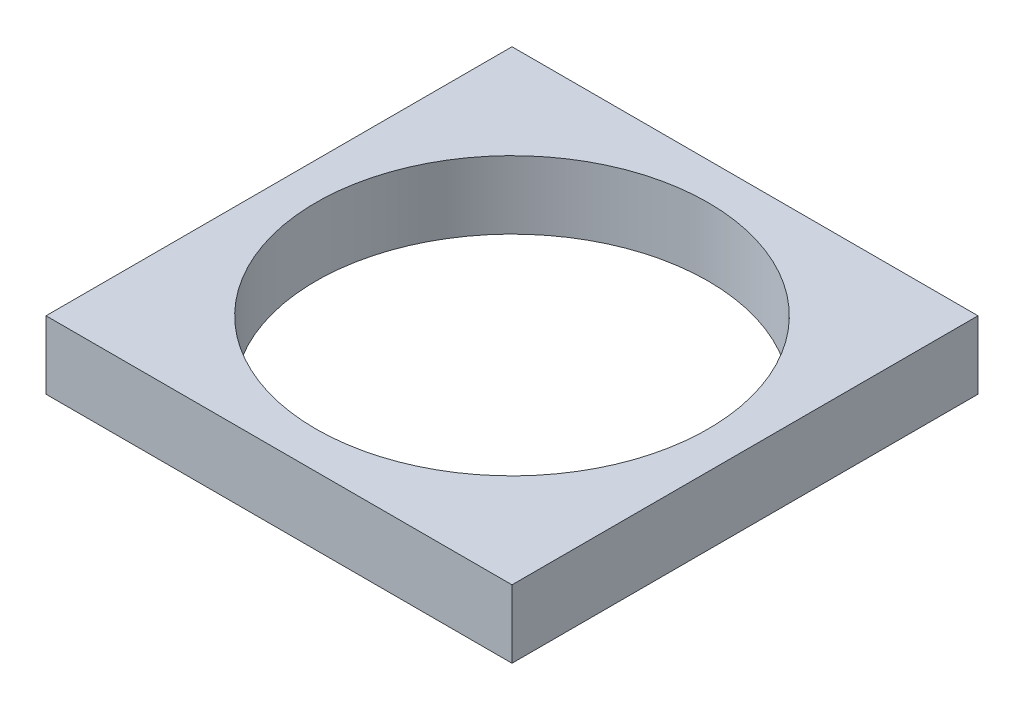
from build123d import *

# Parameters (mm, degrees)
SKETCH1_W           = 152.4
SKETCH1_H           = 152.4
SKETCH1_R           = 64.135
BOSS_EXTRUDE1_DEPTH = 22.225


with BuildPart() as part:
    # Sketch1 → Boss-Extrude1 (new body)
    with BuildSketch(Plane(origin=(0, 0, 0), x_dir=(1, 0, 0), z_dir=(0, 1, 0))):
        Rectangle(SKETCH1_W, SKETCH1_H)
        Circle(SKETCH1_R, mode=Mode.SUBTRACT)
    extrude(amount=BOSS_EXTRUDE1_DEPTH)


solid = part.part
